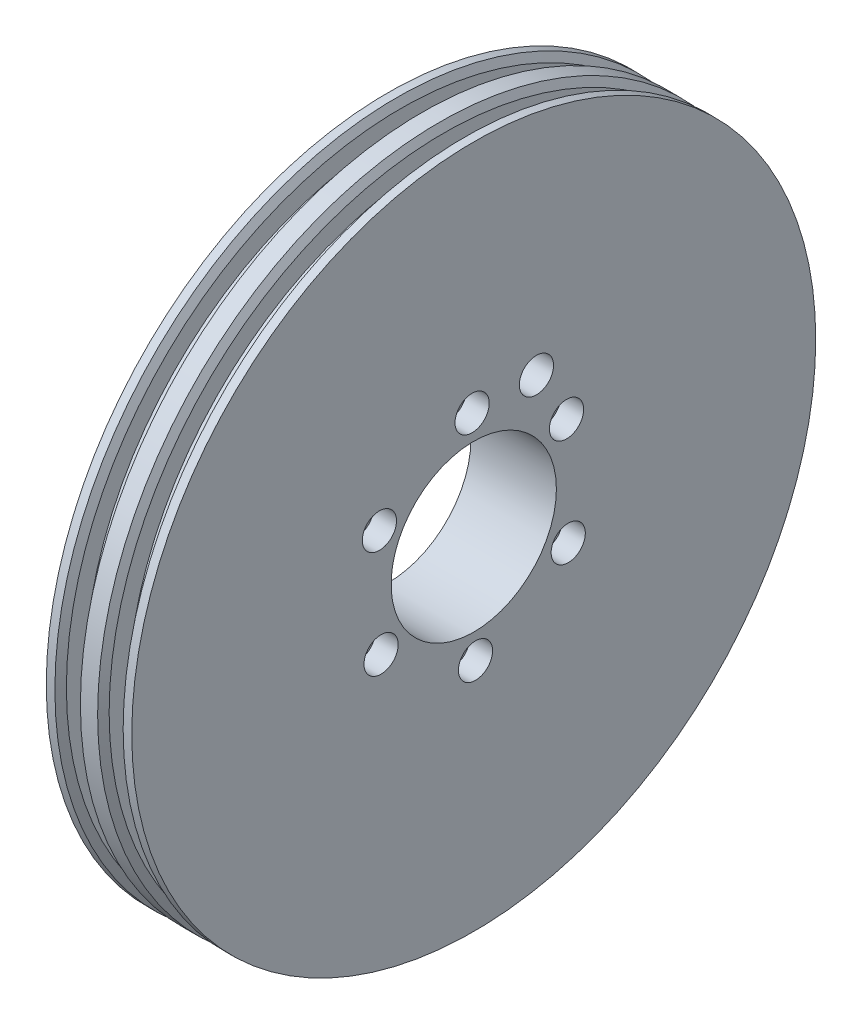
from build123d import *

# Parameters (mm, degrees)
SKETCH1_R           = 60
SKETCH1_R_2         = 14.5
BOSS_EXTRUDE1_DEPTH = 7.5
CUT_EXTRUDE2_REACH  = 88.168
SKETCH3_R           = 2
SKETCH4_R           = 25
SKETCH4_R_2         = 22
CUT_EXTRUDE3_DEPTH  = 3
SKETCH6_R           = 3
CUT_EXTRUDE4_DEPTH  = 4
CUT_EXTRUDE5_REACH  = 88.168
SKETCH7_R           = 3


with BuildPart() as part:
    # Sketch1 → Boss-Extrude1 (new, symmetric)
    with BuildSketch(Plane(origin=(0, 0, 0), x_dir=(0, 0, -1), z_dir=(1, 0, 0))):
        Circle(SKETCH1_R)
        Circle(SKETCH1_R_2, mode=Mode.SUBTRACT)
    extrude(amount=BOSS_EXTRUDE1_DEPTH, both=True)

    # Sketch3 → Cut-Extrude2 (cut, up to next)
    with BuildSketch(Plane(origin=(7.5, 0, 0), x_dir=(0, 0, -1), z_dir=(1, 0, 0)), mode=Mode.PRIVATE) as cut_extrude2_sk1:
        with Locations((0, 19)):
            Circle(SKETCH3_R)
    cut_extrude2_tool1 = extrude(cut_extrude2_sk1.sketch, amount=-CUT_EXTRUDE2_REACH, mode=Mode.PRIVATE) & part.part
    # Sketch3 → Cut-Extrude2 (cut, up to next)
    with BuildSketch(Plane(origin=(7.5, 0, 0), x_dir=(0, 0, -1), z_dir=(1, 0, 0)), mode=Mode.PRIVATE) as cut_extrude2_sk2:
        with Locations((16.454482672, 9.5)):
            Circle(SKETCH3_R)
    cut_extrude2_tool2 = extrude(cut_extrude2_sk2.sketch, amount=-CUT_EXTRUDE2_REACH, mode=Mode.PRIVATE) & part.part
    # Sketch3 → Cut-Extrude2 (cut, up to next)
    with BuildSketch(Plane(origin=(7.5, 0, 0), x_dir=(0, 0, -1), z_dir=(1, 0, 0)), mode=Mode.PRIVATE) as cut_extrude2_sk3:
        with Locations((16.454482672, -9.5)):
            Circle(SKETCH3_R)
    cut_extrude2_tool3 = extrude(cut_extrude2_sk3.sketch, amount=-CUT_EXTRUDE2_REACH, mode=Mode.PRIVATE) & part.part
    # Sketch3 → Cut-Extrude2 (cut, up to next)
    with BuildSketch(Plane(origin=(7.5, 0, 0), x_dir=(0, 0, -1), z_dir=(1, 0, 0)), mode=Mode.PRIVATE) as cut_extrude2_sk4:
        with Locations((0, -19)):
            Circle(SKETCH3_R)
    cut_extrude2_tool4 = extrude(cut_extrude2_sk4.sketch, amount=-CUT_EXTRUDE2_REACH, mode=Mode.PRIVATE) & part.part
    # Sketch3 → Cut-Extrude2 (cut, up to next)
    with BuildSketch(Plane(origin=(7.5, 0, 0), x_dir=(0, 0, -1), z_dir=(1, 0, 0)), mode=Mode.PRIVATE) as cut_extrude2_sk5:
        with Locations((-16.454482672, -9.5)):
            Circle(SKETCH3_R)
    cut_extrude2_tool5 = extrude(cut_extrude2_sk5.sketch, amount=-CUT_EXTRUDE2_REACH, mode=Mode.PRIVATE) & part.part
    # Sketch3 → Cut-Extrude2 (cut, up to next)
    with BuildSketch(Plane(origin=(7.5, 0, 0), x_dir=(0, 0, -1), z_dir=(1, 0, 0)), mode=Mode.PRIVATE) as cut_extrude2_sk6:
        with Locations((-16.454482672, 9.5)):
            Circle(SKETCH3_R)
    cut_extrude2_tool6 = extrude(cut_extrude2_sk6.sketch, amount=-CUT_EXTRUDE2_REACH, mode=Mode.PRIVATE) & part.part
    add(cut_extrude2_tool1.solids().sort_by_distance((7.5, 19, 0))[0], mode=Mode.SUBTRACT)
    add(cut_extrude2_tool2.solids().sort_by_distance((7.5, 9.5, -16.454483))[0], mode=Mode.SUBTRACT)
    add(cut_extrude2_tool3.solids().sort_by_distance((7.5, -9.5, -16.454483))[0], mode=Mode.SUBTRACT)
    add(cut_extrude2_tool4.solids().sort_by_distance((7.5, -19, 0))[0], mode=Mode.SUBTRACT)
    add(cut_extrude2_tool5.solids().sort_by_distance((7.5, -9.5, 16.454483))[0], mode=Mode.SUBTRACT)
    add(cut_extrude2_tool6.solids().sort_by_distance((7.5, 9.5, 16.454483))[0], mode=Mode.SUBTRACT)

    # Sketch4 → Cut-Extrude3 (cut)
    with BuildSketch(Plane.ZY.offset(7.5)):
        Circle(SKETCH4_R)
        Circle(SKETCH4_R_2, mode=Mode.SUBTRACT)
    extrude(amount=-CUT_EXTRUDE3_DEPTH, mode=Mode.SUBTRACT)

    # Sketch5 → Cut-Revolve2 (revolve, cut)
    with BuildSketch(Plane.XY):
        Polygon((5.25, 55.496030983), (2.25, 55.496030983), (2.25, 58.719065255), (1.224068359, 60.496030983), (2.25, 60.496030983), (5.25, 60.496030983), (6.275931641, 60.496030983), (5.25, 58.719065255), align=None)
        Polygon((-2.25, 58.719065255), (-1.224068359, 60.496030983), (-2.25, 60.496030983), (-5.25, 60.496030983), (-6.275931641, 60.496030983), (-5.25, 58.719065255), (-5.25, 55.496030983), (-2.25, 55.496030983), align=None)
    revolve(axis=Axis((7.5, 0, 0), (-1, 0, 0)), mode=Mode.SUBTRACT)

    # Sketch6 → Cut-Extrude4 (cut)
    with BuildSketch(Plane(origin=(7.5, 0, 0), x_dir=(0, 0, -1), z_dir=(1, 0, 0))):
        with Locations((-16.554180106, 9.200931021)):
            Circle(SKETCH6_R)
        with Locations((-0.286871035, 18.93715173)):
            Circle(SKETCH6_R)
        with Locations((16.278597972, 9.717359178)):
            Circle(SKETCH6_R)
        with Locations((16.576757907, -9.238654084)):
            Circle(SKETCH6_R)
        with Locations((0.309448836, -18.974874792)):
            Circle(SKETCH6_R)
        with Locations((-16.256020171, -9.75508224)):
            Circle(SKETCH6_R)
    extrude(amount=-CUT_EXTRUDE4_DEPTH, mode=Mode.SUBTRACT)

    # Sketch7 → Cut-Extrude5 (cut, up to next)
    with BuildSketch(Plane.ZY.offset(7.5), mode=Mode.PRIVATE) as cut_extrude5_sk1:
        with Locations((-11, 19.052558883)):
            Circle(SKETCH7_R)
    cut_extrude5_tool1 = extrude(cut_extrude5_sk1.sketch, amount=-CUT_EXTRUDE5_REACH, mode=Mode.PRIVATE) & part.part
    add(cut_extrude5_tool1.solids().sort_by_distance((-7.5, 19.052559, -11))[0], mode=Mode.SUBTRACT)


solid = part.part
